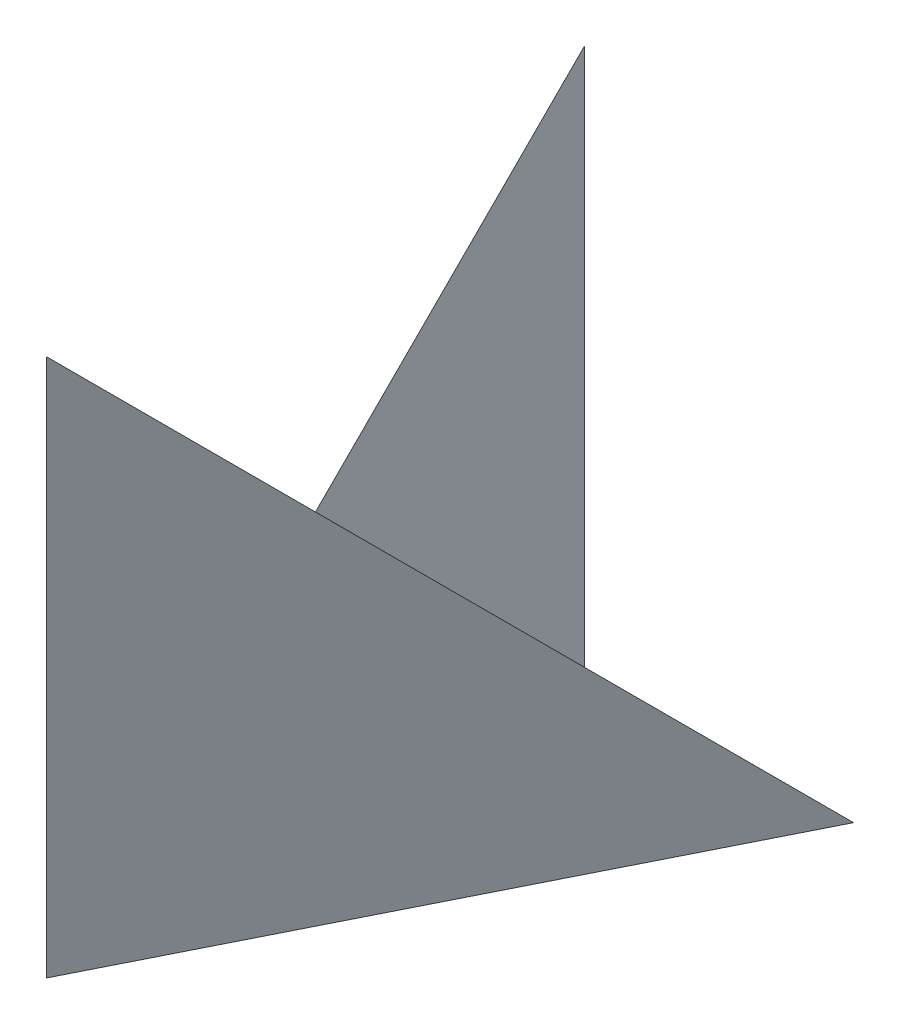
from build123d import *

# Parameters (mm, degrees)
SKETCH1_W           = 4
SKETCH1_H           = 4
BOSS_EXTRUDE1_DEPTH = 4
CHAMFER1_SIZE       = 4
CHAMFER1_SIZE_2     = 2
CUT_EXTRUDE1_DEPTH  = 10
CUT_EXTRUDE3_DEPTH  = 10
CUT_EXTRUDE4_DEPTH  = 10


with BuildPart() as part:
    # Sketch1 → Boss-Extrude1 (new body)
    with BuildSketch(Plane(origin=(0, 0, 0), x_dir=(1, 0, 0), z_dir=(0, 1, 0))):
        Rectangle(SKETCH1_W, SKETCH1_H)
    extrude(amount=BOSS_EXTRUDE1_DEPTH)

    # Chamfer1
    # the kernel refuses this chamfer: 4, 2 mm, written as the material it takes off along each edge
    with BuildSketch(Plane(origin=(2, 4, 12.359315495), x_dir=(0.017268075123668084, -0.9998508956747119, 0), z_dir=(0, 0, -1)), Plane(origin=(-2, 4, -12.359315495), x_dir=(-0.017268075123668084, -0.9998508956747119, 0), z_dir=(0, 0, 1))) as chamfer1_piece_1:
        Polygon((CHAMFER1_SIZE * 0.999850895675, CHAMFER1_SIZE * 0.0172680751237), (-CHAMFER1_SIZE_2 * 0.0172680751237, CHAMFER1_SIZE_2 * 0.999850895675), (0, 0), align=None)
    extrude(amount=24.71863099, mode=Mode.SUBTRACT)

    # 3DSketch3 → Cut-Extrude1 (cut, along a direction that is not the sketch's normal)
    with BuildSketch(Plane(origin=(0, 4, -2), x_dir=(0, -0.7071067811865476, 0.7071067811865476), z_dir=(0.816496580927726, -0.408248290463863, -0.408248290463863))):
        Polygon((0, 0), (5.656854249, 0), (2.828427125, 3.464101615), align=None)
    extrude(amount=-CUT_EXTRUDE1_DEPTH, dir=(0, 0, -1), mode=Mode.SUBTRACT)

    # Sketch3 → Cut-Extrude3 (cut)
    with BuildSketch(Plane.XZ):
        Polygon((2, -2), (0, 2), (2, 2), align=None)
    extrude(amount=-CUT_EXTRUDE3_DEPTH, mode=Mode.SUBTRACT)

    # Sketch4 → Cut-Extrude4 (cut)
    with BuildSketch(Plane.ZY):
        Polygon((2, 4), (-2, 4), (-2, 0), align=None)
    extrude(amount=-CUT_EXTRUDE4_DEPTH, mode=Mode.SUBTRACT)


solid = part.part
